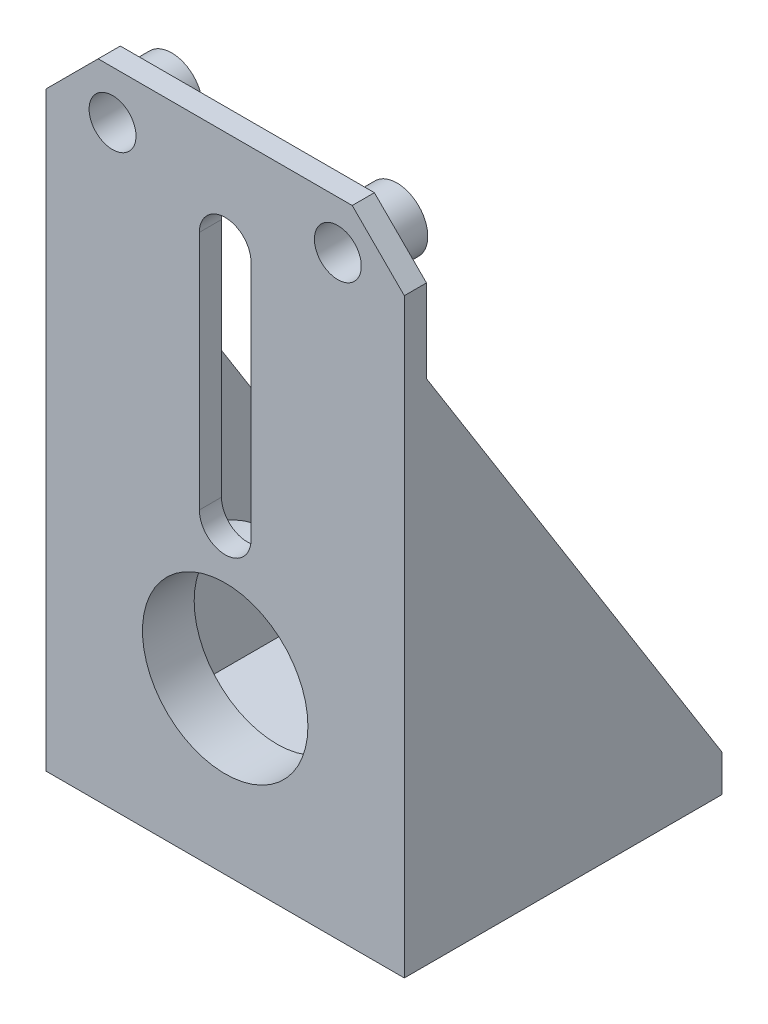
from build123d import *
from OCP.BRepFilletAPI import BRepFilletAPI_MakeChamfer
from build123d.topology import SkipClean

# Parameters (mm, degrees)
SKETCH1_R                = 1.55
SKETCH1_R_2              = 1.5
SKETCH1_R_3              = 11
SKETCH1_R_4              = 3.175
BOSS_EXTRUDE1_DEPTH      = 3
BOSS_EXTRUDE2_START      = 3
SKETCH2_R                = 4.175
SKETCH2_R_2              = 3.175
BOSS_EXTRUDE2_DEPTH      = 3
BOSS_EXTRUDE3_START      = 2
SKETCH3_R                = 4.175
BOSS_EXTRUDE3_DEPTH      = 2
BOSS_EXTRUDE4_DEPTH      = 40
BOSS_EXTRUDE4_DEPTH_BACK = 3
SKETCH5_W                = 3
SKETCH5_H                = 5
BOSS_EXTRUDE5_DEPTH      = 3
BOSS_EXTRUDE7_DEPTH      = 3
BOSS_EXTRUDE9_DEPTH      = 3
BOSS_EXTRUDE10_START     = -3
SKETCH9_R                = 1.55
SKETCH9_R_2              = 1.5
SKETCH9_R_3              = 11
BOSS_EXTRUDE10_DEPTH     = 3
SKETCH10_R               = 11.2
CUT_EXTRUDE1_DEPTH       = 22.7
CUT_EXTRUDE2_DEPTH       = 10
SKETCH12_R               = 13.5
SKETCH12_R_2             = 11.2
BOSS_EXTRUDE11_DEPTH     = 4
SKETCH13_W               = 3
SKETCH13_H               = 76.55
BOSS_EXTRUDE13_DEPTH     = 3
BOSS_EXTRUDE14_DEPTH     = 3
BOSS_EXTRUDE15_DEPTH     = 3
SKETCH16_W               = 0.497079972
SKETCH16_H               = 40
CUT_EXTRUDE3_DEPTH       = 2
CHAMFER1_SIZE            = 3
CHAMFER1_SIZE_2          = 2.99439091
BOSS_EXTRUDE17_DEPTH     = 3


with BuildPart() as part:
    # Sketch1 → Boss-Extrude1 (new body)
    with BuildSketch(Plane.XY):
        Polygon((-33.421286346, -6), (-33.421286346, 36.5), (-33.421286346, 72.55), (-28.421286346, 77.55), (4.078713654, 77.55), (9.078713654, 72.55), (9.078713654, 36.5), (9.078713654, -6), align=None)
        with Locations((2.92772434, 30.5)):
            Circle(SKETCH1_R, mode=Mode.SUBTRACT)
        with Locations(Location((2.92772434, -0.5, 0), (0, 0, 180))):
            Circle(SKETCH1_R_2, mode=Mode.SUBTRACT)
        with Locations((-27.671286346, -0.5)):
            Circle(SKETCH1_R_2, mode=Mode.SUBTRACT)
        with Locations(Location((-28.07227566, 30.5, 0), (0, 0, 180))):
            Circle(SKETCH1_R_2, mode=Mode.SUBTRACT)
        with Locations((-12.171286346, 15.25)):
            Circle(SKETCH1_R_3, mode=Mode.SUBTRACT)
        with Locations((-27.421286346, 71.55)):
            Circle(SKETCH1_R_4, mode=Mode.SUBTRACT)
        with Locations(Location((3.078713654, 71.55, 0), (0, 0, 180))):
            Circle(SKETCH1_R_4, mode=Mode.SUBTRACT)
    extrude(amount=BOSS_EXTRUDE1_DEPTH)

    # Sketch2 → Boss-Extrude2 (add)
    # profile 1 of 2: a face of its own
    with SkipClean():  # the faces are left unmerged after this step: merging them gives an invalid solid
        with BuildSketch(Plane(origin=(0, 0, 0), x_dir=(-1, 0, 0), z_dir=(0, 0, -1)).offset(BOSS_EXTRUDE2_START)):
            with Locations((-3.078713654, 71.55)):
                Circle(SKETCH2_R)
            with Locations((-3.078713654, 71.55)):
                Circle(SKETCH2_R_2, mode=Mode.SUBTRACT)
        # profile 2 of 2: a face of its own
        with BuildSketch(Plane(origin=(0, 0, 0), x_dir=(-1, 0, 0), z_dir=(0, 0, -1)).offset(BOSS_EXTRUDE2_START)):
            with Locations((27.421286346, 71.55)):
                Circle(SKETCH2_R)
            with Locations((27.421286346, 71.55)):
                Circle(SKETCH2_R_2, mode=Mode.SUBTRACT)
        extrude(amount=-BOSS_EXTRUDE2_DEPTH)

    # Sketch3 → Boss-Extrude3 (add)
    with SkipClean():  # the faces are left unmerged after this step: merging them gives an invalid solid
        with BuildSketch(Plane(origin=(0, 0, -3), x_dir=(-1, 0, 0), z_dir=(0, 0, -1)).offset(BOSS_EXTRUDE3_START)):
            with Locations((-3.078713654, 71.55)):
                Circle(SKETCH3_R)
            with Locations((27.421286346, 71.55)):
                Circle(SKETCH3_R)
        extrude(amount=-BOSS_EXTRUDE3_DEPTH)

    # Sketch5 → Boss-Extrude5 (add)
    with SkipClean():  # the faces are left unmerged after this step: merging them gives an invalid solid
        with BuildSketch(Plane.XY.offset(3)):
            with Locations((10.578713654, 45.531399611)):
                Rectangle(SKETCH5_W, SKETCH5_H)
            with Locations((-34.921286346, 45.531399611)):
                Rectangle(SKETCH5_W, SKETCH5_H)
        extrude(amount=-BOSS_EXTRUDE5_DEPTH)



with BuildPart() as body_2:
    # Sketch4 → Boss-Extrude4 (new, two sides: drawn at the far end of the back side and taken through both)
    with BuildSketch(Plane(origin=(0, 0, 0), x_dir=(-1, 0, 0), z_dir=(0, 0, -1)).offset(-BOSS_EXTRUDE4_DEPTH_BACK)):
        Polygon((33.421286346, -6), (-9.078713654, -6), (-9.078713654, -4), (-12.078713654, -4), (-12.078713654, -9), (-9.078713654, -9), (33.259008686, -9), (36.259008686, -9), (36.259008686, -4), (33.259008686, -4), align=None)
    extrude(amount=BOSS_EXTRUDE4_DEPTH + BOSS_EXTRUDE4_DEPTH_BACK)


with BuildPart() as part_1:
    with SkipClean():  # the faces are left unmerged after this step: merging them gives an invalid solid
        add(part.part)

        add(body_2.part)  # Boss-Extrude7 merges body 2
        # Sketch6 → Boss-Extrude7 (add)
        with BuildSketch(Plane(origin=(9.078713654, 0, 0), x_dir=(0, 0, -1), z_dir=(1, 0, 0))):
            Polygon((0, 48.031399611), (40, -4), (36.156167209, -4), (0, 43.031399611), align=None)
        extrude(amount=BOSS_EXTRUDE7_DEPTH)

    # Sketch8 → Boss-Extrude9 (add)
    with BuildSketch(Plane.ZY.offset(36.421286346)):
        Polygon((0, 48.031399611), (0, 43.031399611), (-36.156167209, -4), (-40, -4), align=None)
    extrude(amount=-BOSS_EXTRUDE9_DEPTH)

    # Sketch9 → Boss-Extrude10 (add)
    with BuildSketch(Plane.XY.offset(3).offset(BOSS_EXTRUDE10_START)):
        with Locations((2.92772434, 30.5)):
            Circle(SKETCH9_R)
        with Locations((-28.07227566, 30.5)):
            Circle(SKETCH9_R_2)
        with Locations((-27.671286346, -0.5)):
            Circle(SKETCH9_R_2)
        with Locations((2.92772434, -0.5)):
            Circle(SKETCH9_R_2)
        with Locations((-12.171286346, 15.25)):
            Circle(SKETCH9_R_3)
    extrude(amount=BOSS_EXTRUDE10_DEPTH)

    # Sketch10 → Cut-Extrude1 (cut)
    with BuildSketch(Plane.XY.offset(3)):
        with Locations((-12.171286346, 14)):
            Circle(SKETCH10_R)
    extrude(amount=-CUT_EXTRUDE1_DEPTH, mode=Mode.SUBTRACT)

    # Sketch11 → Cut-Extrude2 (cut)
    with BuildSketch(Plane.XY.offset(3)):
        with BuildLine():
            Line((-8.671286346, 64.55), (-8.671286346, 32))
            ThreePointArc((-8.671286346, 32), (-12.171286346, 28.5), (-15.671286346, 32))
            Line((-15.671286346, 32), (-15.671286346, 64.55))
            ThreePointArc((-15.671286346, 64.55), (-12.171286346, 68.05), (-8.671286346, 64.55))
        make_face()
    extrude(amount=-CUT_EXTRUDE2_DEPTH, mode=Mode.SUBTRACT)

    # Sketch12 → Boss-Extrude11 (add)
    with BuildSketch(Plane(origin=(0, 0, 0), x_dir=(-1, 0, 0), z_dir=(0, 0, -1))):
        with Locations((12.171286346, 14)):
            Circle(SKETCH12_R)
        with Locations(Location((12.171286346, 14, 0), (0, 0, 180))):
            Circle(SKETCH12_R_2, mode=Mode.SUBTRACT)
    extrude(amount=BOSS_EXTRUDE11_DEPTH)

    # Sketch13 → Boss-Extrude13 (add)
    with BuildSketch(Plane.XY.offset(3)):
        with Locations((-34.921286346, 34.275)):
            Rectangle(SKETCH13_W, SKETCH13_H)
        Polygon((12.078713654, -4), (9.078713654, -4), (9.078713654, 72.55), (12.078713654, 72.555624881), align=None)
    extrude(amount=-BOSS_EXTRUDE13_DEPTH)

    # Sketch14 → Boss-Extrude14 (add)
    with BuildSketch(Plane(origin=(12.078713654, 0, 0), x_dir=(0, 0, -1), z_dir=(1, 0, 0))):
        Polygon((-3, 64.55), (-3, -9), (40, -9), (40, -4), align=None)
    extrude(amount=-BOSS_EXTRUDE14_DEPTH)

    # Sketch15 → Boss-Extrude15 (add)
    with BuildSketch(Plane.ZY.offset(36.421286346)):
        Polygon((3, 64.55), (-40, -4), (-40, -9), (3, -9), align=None)
    extrude(amount=-BOSS_EXTRUDE15_DEPTH)

    # Sketch16 → Cut-Extrude3 (cut)
    with BuildSketch(Plane(origin=(0, -4, 0), x_dir=(1, 0, 0), z_dir=(0, 1, 0))):
        with Locations((-33.17274636, 20)):
            Rectangle(SKETCH16_W, SKETCH16_H)
    extrude(amount=-CUT_EXTRUDE3_DEPTH, mode=Mode.SUBTRACT)

    # Chamfer1
    chamfer1_edges_1 = [part_1.edges().sort_by_distance(p)[0] for p in [
        (-36.421286346, 72.55, 1.5),
    ]]
    chamfer1_edges_2 = [part_1.edges().sort_by_distance(p)[0] for p in [
        (12.078713654, 72.555624881, 1.5),
    ]]
    chamfer1_side_2 = [part_1.faces().sort_by_distance(p)[0] for p in [
        (12.018825941, 72.555512593, 1.5),
    ]]
    chamfer1 = BRepFilletAPI_MakeChamfer(part_1.part.solid().wrapped)
    for e in chamfer1_edges_1:
        chamfer1.Add(CHAMFER1_SIZE - 0.0001, e.wrapped)
    for e in chamfer1_edges_2:
        chamfer1.Add(CHAMFER1_SIZE - 0.0001, CHAMFER1_SIZE_2 - 0.0001, e.wrapped, chamfer1_side_2[0].wrapped)
    add(Compound.cast(chamfer1.Shape()), mode=Mode.REPLACE)  # a hair under: the kernel refuses the full size

    # Sketch17 → Boss-Extrude17 (add)
    with BuildSketch(Plane.XY.offset(3)):
        Polygon((-33.421286346, 72.55), (-28.421286346, 77.55), (-12.171286346, 77.55), (-12.171286346, 78.05), (-29.370903561, 78.05), (-36.421286346, 70.999617215), (-36.421286346, 69.55), align=None)
        Polygon((-12.171286346, 78.05), (-12.171286346, 77.55), (4.078713654, 77.55), (9.078713654, 72.55), (12.078713654, 69.561233971), (12.078713654, 70.999617215), (5.028330869, 78.05), align=None)
    extrude(amount=-BOSS_EXTRUDE17_DEPTH)


solid = part_1.part
